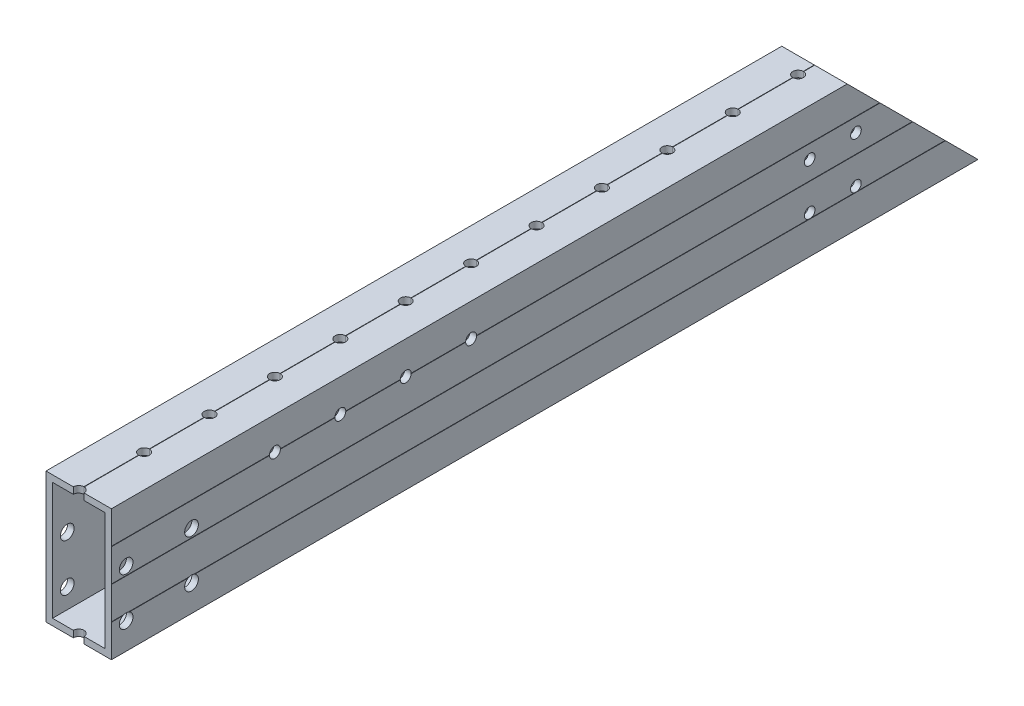
from build123d import *

# Parameters (mm, degrees)
CUT_EXTRUDE1_START          = -25.4
CUT_EXTRUDE1_OUTLINE_W      = 2.54
CUT_EXTRUDE1_OUTLINE_H      = 609.6
CUT_EXTRUDE1_DEPTH          = 50.8
CUT_EXTRUDE1_2_OUTLINE_W    = 20.32
CUT_EXTRUDE1_2_OUTLINE_H    = 609.6
CUT_EXTRUDE1_2_OUTLINE_R    = 2.0701
CUT_EXTRUDE1_2_DEPTH        = 2.54
CUT_EXTRUDE1_START_2        = 22.86
CUT_EXTRUDE1_3_OUTLINE_W    = 20.32
CUT_EXTRUDE1_3_OUTLINE_H    = 609.6
CUT_EXTRUDE1_3_OUTLINE_R    = 2.0701
CUT_EXTRUDE1_3_DEPTH        = 2.54
CUT_EXTRUDE1_START_3        = -17.906630705
CUT_EXTRUDE1_4_OUTLINE_W    = 8.980256121
CUT_EXTRUDE1_4_OUTLINE_H    = 613
CUT_EXTRUDE1_4_DEPTH        = 8.980256121
CUT_EXTRUDE1_START_4        = 8.926374584
CUT_EXTRUDE1_5_OUTLINE_W    = 8.980256121
CUT_EXTRUDE1_5_OUTLINE_H    = 613
CUT_EXTRUDE1_5_DEPTH        = 0.107763074
CUT_EXTRUDE1_START_5        = -0.053881537
CUT_EXTRUDE1_6_OUTLINE_W    = 2.093369295
CUT_EXTRUDE1_6_OUTLINE_H    = 613
CUT_EXTRUDE1_6_DEPTH        = 0.107763074
CUT_EXTRUDE1_START_6        = -26.940768363
CUT_EXTRUDE1_7_OUTLINE_W    = 2.093369295
CUT_EXTRUDE1_7_OUTLINE_H    = 613
CUT_EXTRUDE1_7_OUTLINE_W_2  = 0.107763074
CUT_EXTRUDE1_7_DEPTH        = 9.034137658
CUT_EXTRUDE1_START_7        = 17.906630705
CUT_EXTRUDE1_8_OUTLINE_W    = 0.107763074
CUT_EXTRUDE1_8_OUTLINE_H    = 613
CUT_EXTRUDE1_8_OUTLINE_W_2  = 2.093369295
CUT_EXTRUDE1_8_DEPTH        = 9.034137658
SKETCH3_W                   = 25.4
SKETCH3_H                   = 50.8
CUT_EXTRUDE3_DEPTH          = 25.4
CUT_EXTRUDE4_REACH          = 752.161
SKETCH7_W                   = 25.4
SKETCH7_H                   = 50.8
CUT_EXTRUDE6_DEPTH          = 12.7
SKETCH6_W                   = 25.4
SKETCH6_H                   = 50.8
CUT_EXTRUDE7_DEPTH          = 234.95
CUT_EXTRUDE8_DEPTH          = 234.95
CUT_EXTRUDE9_REACH          = 517.603
SKETCH9_R                   = 2.667
F_1_4_0_25_DIAMETER_HOLE1_D = 4.2545
F_1_4_0_25_DIAMETER_HOLE2_D = 4.1402


with BuildPart() as part:
    # Cut-Extrude1: read off the stored shape, not the designer's step
    # Cut-Extrude1 outline → Cut-Extrude1 (new body)
    with BuildSketch(Plane(origin=(0, 0, 0), x_dir=(1, 0, 0), z_dir=(0, 1, 0)).offset(CUT_EXTRUDE1_START)):
        with Locations((-11.43, 444.5)):
            Rectangle(CUT_EXTRUDE1_OUTLINE_W, CUT_EXTRUDE1_OUTLINE_H)
        with Locations((11.43, 444.5)):
            Rectangle(CUT_EXTRUDE1_OUTLINE_W, CUT_EXTRUDE1_OUTLINE_H)
    extrude(amount=CUT_EXTRUDE1_DEPTH)

    # Cut-Extrude1 2 outline → Cut-Extrude1 2 (add)
    with BuildSketch(Plane(origin=(0, 0, 0), x_dir=(1, 0, 0), z_dir=(0, 1, 0)).offset(CUT_EXTRUDE1_START)):
        with Locations((0, 444.5)):
            Rectangle(CUT_EXTRUDE1_2_OUTLINE_W, CUT_EXTRUDE1_2_OUTLINE_H)
        with Locations((0, 152.4)):
            Circle(CUT_EXTRUDE1_2_OUTLINE_R, mode=Mode.SUBTRACT)
        with Locations((0, 177.8)):
            Circle(CUT_EXTRUDE1_2_OUTLINE_R, mode=Mode.SUBTRACT)
        with Locations((0, 203.2)):
            Circle(CUT_EXTRUDE1_2_OUTLINE_R, mode=Mode.SUBTRACT)
        with Locations((0, 228.6)):
            Circle(CUT_EXTRUDE1_2_OUTLINE_R, mode=Mode.SUBTRACT)
        with Locations((0, 254)):
            Circle(CUT_EXTRUDE1_2_OUTLINE_R, mode=Mode.SUBTRACT)
        with Locations((0, 279.4)):
            Circle(CUT_EXTRUDE1_2_OUTLINE_R, mode=Mode.SUBTRACT)
        with Locations((0, 304.8)):
            Circle(CUT_EXTRUDE1_2_OUTLINE_R, mode=Mode.SUBTRACT)
        with Locations((0, 330.2)):
            Circle(CUT_EXTRUDE1_2_OUTLINE_R, mode=Mode.SUBTRACT)
        with Locations((0, 355.6)):
            Circle(CUT_EXTRUDE1_2_OUTLINE_R, mode=Mode.SUBTRACT)
        with Locations((0, 381)):
            Circle(CUT_EXTRUDE1_2_OUTLINE_R, mode=Mode.SUBTRACT)
        with Locations((0, 406.4)):
            Circle(CUT_EXTRUDE1_2_OUTLINE_R, mode=Mode.SUBTRACT)
        with Locations((0, 431.8)):
            Circle(CUT_EXTRUDE1_2_OUTLINE_R, mode=Mode.SUBTRACT)
        with Locations((0, 457.2)):
            Circle(CUT_EXTRUDE1_2_OUTLINE_R, mode=Mode.SUBTRACT)
        with Locations((0, 482.6)):
            Circle(CUT_EXTRUDE1_2_OUTLINE_R, mode=Mode.SUBTRACT)
        with Locations((0, 508)):
            Circle(CUT_EXTRUDE1_2_OUTLINE_R, mode=Mode.SUBTRACT)
        with Locations((0, 533.4)):
            Circle(CUT_EXTRUDE1_2_OUTLINE_R, mode=Mode.SUBTRACT)
        with Locations((0, 558.8)):
            Circle(CUT_EXTRUDE1_2_OUTLINE_R, mode=Mode.SUBTRACT)
        with Locations((0, 584.2)):
            Circle(CUT_EXTRUDE1_2_OUTLINE_R, mode=Mode.SUBTRACT)
        with Locations((0, 609.6)):
            Circle(CUT_EXTRUDE1_2_OUTLINE_R, mode=Mode.SUBTRACT)
        with Locations((0, 635)):
            Circle(CUT_EXTRUDE1_2_OUTLINE_R, mode=Mode.SUBTRACT)
        with Locations((0, 660.4)):
            Circle(CUT_EXTRUDE1_2_OUTLINE_R, mode=Mode.SUBTRACT)
        with Locations((0, 685.8)):
            Circle(CUT_EXTRUDE1_2_OUTLINE_R, mode=Mode.SUBTRACT)
        with Locations((0, 711.2)):
            Circle(CUT_EXTRUDE1_2_OUTLINE_R, mode=Mode.SUBTRACT)
        with Locations((0, 736.6)):
            Circle(CUT_EXTRUDE1_2_OUTLINE_R, mode=Mode.SUBTRACT)
    extrude(amount=CUT_EXTRUDE1_2_DEPTH)

    # Cut-Extrude1 3 outline → Cut-Extrude1 3 (add)
    with BuildSketch(Plane(origin=(0, 0, 0), x_dir=(1, 0, 0), z_dir=(0, 1, 0)).offset(CUT_EXTRUDE1_START_2)):
        with Locations((0, 444.5)):
            Rectangle(CUT_EXTRUDE1_3_OUTLINE_W, CUT_EXTRUDE1_3_OUTLINE_H)
        with Locations((0, 152.4)):
            Circle(CUT_EXTRUDE1_3_OUTLINE_R, mode=Mode.SUBTRACT)
        with Locations((0, 177.8)):
            Circle(CUT_EXTRUDE1_3_OUTLINE_R, mode=Mode.SUBTRACT)
        with Locations((0, 203.2)):
            Circle(CUT_EXTRUDE1_3_OUTLINE_R, mode=Mode.SUBTRACT)
        with Locations((0, 228.6)):
            Circle(CUT_EXTRUDE1_3_OUTLINE_R, mode=Mode.SUBTRACT)
        with Locations((0, 254)):
            Circle(CUT_EXTRUDE1_3_OUTLINE_R, mode=Mode.SUBTRACT)
        with Locations((0, 279.4)):
            Circle(CUT_EXTRUDE1_3_OUTLINE_R, mode=Mode.SUBTRACT)
        with Locations((0, 304.8)):
            Circle(CUT_EXTRUDE1_3_OUTLINE_R, mode=Mode.SUBTRACT)
        with Locations((0, 330.2)):
            Circle(CUT_EXTRUDE1_3_OUTLINE_R, mode=Mode.SUBTRACT)
        with Locations((0, 355.6)):
            Circle(CUT_EXTRUDE1_3_OUTLINE_R, mode=Mode.SUBTRACT)
        with Locations((0, 381)):
            Circle(CUT_EXTRUDE1_3_OUTLINE_R, mode=Mode.SUBTRACT)
        with Locations((0, 406.4)):
            Circle(CUT_EXTRUDE1_3_OUTLINE_R, mode=Mode.SUBTRACT)
        with Locations((0, 431.8)):
            Circle(CUT_EXTRUDE1_3_OUTLINE_R, mode=Mode.SUBTRACT)
        with Locations((0, 457.2)):
            Circle(CUT_EXTRUDE1_3_OUTLINE_R, mode=Mode.SUBTRACT)
        with Locations((0, 482.6)):
            Circle(CUT_EXTRUDE1_3_OUTLINE_R, mode=Mode.SUBTRACT)
        with Locations((0, 508)):
            Circle(CUT_EXTRUDE1_3_OUTLINE_R, mode=Mode.SUBTRACT)
        with Locations((0, 533.4)):
            Circle(CUT_EXTRUDE1_3_OUTLINE_R, mode=Mode.SUBTRACT)
        with Locations((0, 558.8)):
            Circle(CUT_EXTRUDE1_3_OUTLINE_R, mode=Mode.SUBTRACT)
        with Locations((0, 584.2)):
            Circle(CUT_EXTRUDE1_3_OUTLINE_R, mode=Mode.SUBTRACT)
        with Locations((0, 609.6)):
            Circle(CUT_EXTRUDE1_3_OUTLINE_R, mode=Mode.SUBTRACT)
        with Locations((0, 635)):
            Circle(CUT_EXTRUDE1_3_OUTLINE_R, mode=Mode.SUBTRACT)
        with Locations((0, 660.4)):
            Circle(CUT_EXTRUDE1_3_OUTLINE_R, mode=Mode.SUBTRACT)
        with Locations((0, 685.8)):
            Circle(CUT_EXTRUDE1_3_OUTLINE_R, mode=Mode.SUBTRACT)
        with Locations((0, 711.2)):
            Circle(CUT_EXTRUDE1_3_OUTLINE_R, mode=Mode.SUBTRACT)
        with Locations((0, 736.6)):
            Circle(CUT_EXTRUDE1_3_OUTLINE_R, mode=Mode.SUBTRACT)
    extrude(amount=CUT_EXTRUDE1_3_DEPTH)

    # Cut-Extrude1 4 outline → Cut-Extrude1 4 (cut)
    with BuildSketch(Plane(origin=(0, 0, 0), x_dir=(0.7071067811865493, 0.7071067811865457, 0), z_dir=(0.7071067811865456, -0.7071067811865496, 0)).offset(CUT_EXTRUDE1_START_3)):
        with Locations((-13.416502645, -444.5)):
            Rectangle(CUT_EXTRUDE1_4_OUTLINE_W, CUT_EXTRUDE1_4_OUTLINE_H)
    extrude(amount=CUT_EXTRUDE1_4_DEPTH, mode=Mode.SUBTRACT)

    # Cut-Extrude1 5 outline → Cut-Extrude1 5 (cut)
    with BuildSketch(Plane(origin=(0, 0, 0), x_dir=(0.7071067811865493, 0.7071067811865457, 0), z_dir=(0.7071067811865456, -0.7071067811865496, 0)).offset(CUT_EXTRUDE1_START_4)):
        with Locations((13.416502645, -444.5)):
            Rectangle(CUT_EXTRUDE1_5_OUTLINE_W, CUT_EXTRUDE1_5_OUTLINE_H)
    extrude(amount=CUT_EXTRUDE1_5_DEPTH, mode=Mode.SUBTRACT)

    # Cut-Extrude1 6 outline → Cut-Extrude1 6 (cut)
    with BuildSketch(Plane(origin=(0, 0, 0), x_dir=(0.7071067811865493, 0.7071067811865457, 0), z_dir=(0.7071067811865456, -0.7071067811865496, 0)).offset(CUT_EXTRUDE1_START_5)):
        with Locations((18.953315352, -444.5)):
            Rectangle(CUT_EXTRUDE1_6_OUTLINE_W, CUT_EXTRUDE1_6_OUTLINE_H)
        with Locations((-18.953315352, -444.5)):
            Rectangle(CUT_EXTRUDE1_6_OUTLINE_W, CUT_EXTRUDE1_6_OUTLINE_H)
    extrude(amount=CUT_EXTRUDE1_6_DEPTH, mode=Mode.SUBTRACT)

    # Cut-Extrude1 7 outline → Cut-Extrude1 7 (cut)
    with BuildSketch(Plane(origin=(0, 0, 0), x_dir=(0.7071067811865493, 0.7071067811865457, 0), z_dir=(0.7071067811865456, -0.7071067811865496, 0)).offset(CUT_EXTRUDE1_START_6)):
        with Locations((18.953315352, -444.5)):
            Rectangle(CUT_EXTRUDE1_7_OUTLINE_W, CUT_EXTRUDE1_7_OUTLINE_H)
        with Locations((0, -444.5)):
            Rectangle(CUT_EXTRUDE1_7_OUTLINE_W_2, CUT_EXTRUDE1_7_OUTLINE_H)
    extrude(amount=CUT_EXTRUDE1_7_DEPTH, mode=Mode.SUBTRACT)

    # Cut-Extrude1 8 outline → Cut-Extrude1 8 (cut)
    with BuildSketch(Plane(origin=(0, 0, 0), x_dir=(0.7071067811865493, 0.7071067811865457, 0), z_dir=(0.7071067811865456, -0.7071067811865496, 0)).offset(CUT_EXTRUDE1_START_7)):
        with Locations((0, -444.5)):
            Rectangle(CUT_EXTRUDE1_8_OUTLINE_W, CUT_EXTRUDE1_8_OUTLINE_H)
        with Locations((-18.953315352, -444.5)):
            Rectangle(CUT_EXTRUDE1_8_OUTLINE_W_2, CUT_EXTRUDE1_8_OUTLINE_H)
    extrude(amount=CUT_EXTRUDE1_8_DEPTH, mode=Mode.SUBTRACT)

    # Sketch3 → Cut-Extrude3 (cut)
    with BuildSketch(Plane.XY.offset(-139.7)):
        Rectangle(SKETCH3_W, SKETCH3_H)
    extrude(amount=-CUT_EXTRUDE3_DEPTH, mode=Mode.SUBTRACT)

    # Cut-Extrude4: up to this face of the body (flat: up to its plane)
    cut_extrude4_end = Plane(part.part.faces().sort_by_distance((12.7, -6.35, -457.2))[0])
    # Sketch5 → Cut-Extrude4 (cut, up to the picked face)
    with BuildSketch(Plane.ZY.offset(12.7), mode=Mode.PRIVATE) as cut_extrude4_sk1:
        with BuildLine():
            ThreePointArc((-708.533, -0.0762), (-711.2, 2.5908), (-713.867, -0.0762))
            Line((-713.867, -0.0762), (-711.2, -0.0762))
            Line((-711.2, -0.0762), (-708.533, -0.0762))
        make_face()
    cut_extrude4_tool1 = split(extrude(cut_extrude4_sk1.sketch, amount=-CUT_EXTRUDE4_REACH, mode=Mode.PRIVATE), bisect_by=cut_extrude4_end, keep=Keep.BOTH, mode=Mode.PRIVATE)
    # Sketch5 → Cut-Extrude4 (cut, up to the picked face)
    with BuildSketch(Plane.ZY.offset(12.7), mode=Mode.PRIVATE) as cut_extrude4_sk2:
        with BuildLine():
            Line((-711.2, -0.0762), (-713.867, -0.0762))
            ThreePointArc((-713.867, -0.0762), (-711.2, -2.7432), (-708.533, -0.0762))
            Line((-708.533, -0.0762), (-711.2, -0.0762))
        make_face()
    cut_extrude4_tool2 = split(extrude(cut_extrude4_sk2.sketch, amount=-CUT_EXTRUDE4_REACH, mode=Mode.PRIVATE), bisect_by=cut_extrude4_end, keep=Keep.BOTH, mode=Mode.PRIVATE)
    # Sketch5 → Cut-Extrude4 (cut, up to the picked face)
    with BuildSketch(Plane.ZY.offset(12.7), mode=Mode.PRIVATE) as cut_extrude4_sk3:
        with BuildLine():
            ThreePointArc((-708.533, -0.0762), (-711.2, 2.5908), (-713.867, -0.0762))
            Line((-713.867, -0.0762), (-711.2, -0.0762))
            Line((-711.2, -0.0762), (-708.533, -0.0762))
        make_face()
    cut_extrude4_tool3 = split(extrude(cut_extrude4_sk3.sketch, amount=-CUT_EXTRUDE4_REACH, mode=Mode.PRIVATE), bisect_by=cut_extrude4_end, keep=Keep.BOTH, mode=Mode.PRIVATE)
    # Sketch5 → Cut-Extrude4 (cut, up to the picked face)
    with BuildSketch(Plane.ZY.offset(12.7), mode=Mode.PRIVATE) as cut_extrude4_sk4:
        with BuildLine():
            Line((-711.2, -0.0762), (-713.867, -0.0762))
            ThreePointArc((-713.867, -0.0762), (-711.2, -2.7432), (-708.533, -0.0762))
            Line((-708.533, -0.0762), (-711.2, -0.0762))
        make_face()
    cut_extrude4_tool4 = split(extrude(cut_extrude4_sk4.sketch, amount=-CUT_EXTRUDE4_REACH, mode=Mode.PRIVATE), bisect_by=cut_extrude4_end, keep=Keep.BOTH, mode=Mode.PRIVATE)
    # Sketch5 → Cut-Extrude4 (cut, up to the picked face)
    with BuildSketch(Plane.ZY.offset(12.7), mode=Mode.PRIVATE) as cut_extrude4_sk5:
        with BuildLine():
            ThreePointArc((-673.481, -0.0762), (-676.148, 2.5908), (-678.815, -0.0762))
            Line((-678.815, -0.0762), (-673.481, -0.0762))
        make_face()
    cut_extrude4_tool5 = split(extrude(cut_extrude4_sk5.sketch, amount=-CUT_EXTRUDE4_REACH, mode=Mode.PRIVATE), bisect_by=cut_extrude4_end, keep=Keep.BOTH, mode=Mode.PRIVATE)
    # Sketch5 → Cut-Extrude4 (cut, up to the picked face)
    with BuildSketch(Plane.ZY.offset(12.7), mode=Mode.PRIVATE) as cut_extrude4_sk6:
        with BuildLine():
            Line((-673.481, -0.0762), (-678.815, -0.0762))
            ThreePointArc((-678.815, -0.0762), (-676.148, -2.7432), (-673.481, -0.0762))
        make_face()
    cut_extrude4_tool6 = split(extrude(cut_extrude4_sk6.sketch, amount=-CUT_EXTRUDE4_REACH, mode=Mode.PRIVATE), bisect_by=cut_extrude4_end, keep=Keep.BOTH, mode=Mode.PRIVATE)
    # Sketch5 → Cut-Extrude4 (cut, up to the picked face)
    with BuildSketch(Plane.ZY.offset(12.7), mode=Mode.PRIVATE) as cut_extrude4_sk7:
        with BuildLine():
            ThreePointArc((-673.481, -0.0762), (-676.148, 2.5908), (-678.815, -0.0762))
            Line((-678.815, -0.0762), (-673.481, -0.0762))
        make_face()
    cut_extrude4_tool7 = split(extrude(cut_extrude4_sk7.sketch, amount=-CUT_EXTRUDE4_REACH, mode=Mode.PRIVATE), bisect_by=cut_extrude4_end, keep=Keep.BOTH, mode=Mode.PRIVATE)
    # Sketch5 → Cut-Extrude4 (cut, up to the picked face)
    with BuildSketch(Plane.ZY.offset(12.7), mode=Mode.PRIVATE) as cut_extrude4_sk8:
        with BuildLine():
            Line((-673.481, -0.0762), (-678.815, -0.0762))
            ThreePointArc((-678.815, -0.0762), (-676.148, -2.7432), (-673.481, -0.0762))
        make_face()
    cut_extrude4_tool8 = split(extrude(cut_extrude4_sk8.sketch, amount=-CUT_EXTRUDE4_REACH, mode=Mode.PRIVATE), bisect_by=cut_extrude4_end, keep=Keep.BOTH, mode=Mode.PRIVATE)
    add(cut_extrude4_tool1.solids().sort_by(Axis((-12.7, 1.05571, -711.2), (1, 0, 0)))[0], mode=Mode.SUBTRACT)
    add(cut_extrude4_tool2.solids().sort_by(Axis((-12.7, -1.20811, -711.2), (1, 0, 0)))[0], mode=Mode.SUBTRACT)
    add(cut_extrude4_tool3.solids().sort_by(Axis((-12.7, 1.05571, -711.2), (1, 0, 0)))[0], mode=Mode.SUBTRACT)
    add(cut_extrude4_tool4.solids().sort_by(Axis((-12.7, -1.20811, -711.2), (1, 0, 0)))[0], mode=Mode.SUBTRACT)
    add(cut_extrude4_tool5.solids().sort_by(Axis((-12.7, 1.05571, -676.148), (1, 0, 0)))[0], mode=Mode.SUBTRACT)
    add(cut_extrude4_tool6.solids().sort_by(Axis((-12.7, -1.20811, -676.148), (1, 0, 0)))[0], mode=Mode.SUBTRACT)
    add(cut_extrude4_tool7.solids().sort_by(Axis((-12.7, 1.05571, -676.148), (1, 0, 0)))[0], mode=Mode.SUBTRACT)
    add(cut_extrude4_tool8.solids().sort_by(Axis((-12.7, -1.20811, -676.148), (1, 0, 0)))[0], mode=Mode.SUBTRACT)

    # Sketch7 → Cut-Extrude6 (cut)
    with BuildSketch(Plane.XY.offset(-165.1)):
        Rectangle(SKETCH7_W, SKETCH7_H)
    extrude(amount=-CUT_EXTRUDE6_DEPTH, mode=Mode.SUBTRACT)

    # Sketch6 → Cut-Extrude7 (cut)
    with BuildSketch(Plane(origin=(0, 0, -749.3), x_dir=(-1, 0, 0), z_dir=(0, 0, -1))):
        Rectangle(SKETCH6_W, SKETCH6_H)
    extrude(amount=-CUT_EXTRUDE7_DEPTH, mode=Mode.SUBTRACT)

    # Sketch8 → Cut-Extrude8 (cut)
    with BuildSketch(Plane(origin=(12.7, 0, 0), x_dir=(0, 0, -1), z_dir=(1, 0, 0))):
        Polygon((514.35, -25.4), (463.55, 25.4), (514.35, 25.4), align=None)
    extrude(amount=-CUT_EXTRUDE8_DEPTH, mode=Mode.SUBTRACT)

    # Cut-Extrude9: up to this face of the body (flat: up to its plane)
    cut_extrude9_end = Plane(part.part.faces().sort_by_distance((12.7, -19.128313492, -342.939156746))[0])
    # Sketch9 → Cut-Extrude9 (cut, up to the picked face)
    with BuildSketch(Plane.ZY.offset(12.7), mode=Mode.PRIVATE) as cut_extrude9_sk1:
        with Locations(Location((-208.915, -15.122902698, 0), (0, 0, 61.63072775))):
            Circle(SKETCH9_R)
    cut_extrude9_tool1 = split(extrude(cut_extrude9_sk1.sketch, amount=-CUT_EXTRUDE9_REACH, mode=Mode.PRIVATE), bisect_by=cut_extrude9_end, keep=Keep.BOTH, mode=Mode.PRIVATE)
    # Sketch9 → Cut-Extrude9 (cut, up to the picked face)
    with BuildSketch(Plane.ZY.offset(12.7), mode=Mode.PRIVATE) as cut_extrude9_sk2:
        with Locations((-208.915, 3.279397302)):
            Circle(SKETCH9_R)
    cut_extrude9_tool2 = split(extrude(cut_extrude9_sk2.sketch, amount=-CUT_EXTRUDE9_REACH, mode=Mode.PRIVATE), bisect_by=cut_extrude9_end, keep=Keep.BOTH, mode=Mode.PRIVATE)
    # Sketch9 → Cut-Extrude9 (cut, up to the picked face)
    with BuildSketch(Plane.ZY.offset(12.7), mode=Mode.PRIVATE) as cut_extrude9_sk3:
        with Locations((-183.515, 3.279397302)):
            Circle(SKETCH9_R)
    cut_extrude9_tool3 = split(extrude(cut_extrude9_sk3.sketch, amount=-CUT_EXTRUDE9_REACH, mode=Mode.PRIVATE), bisect_by=cut_extrude9_end, keep=Keep.BOTH, mode=Mode.PRIVATE)
    # Sketch9 → Cut-Extrude9 (cut, up to the picked face)
    with BuildSketch(Plane.ZY.offset(12.7), mode=Mode.PRIVATE) as cut_extrude9_sk4:
        with Locations(Location((-183.515, -15.122902698, 0), (0, 0, 61.63072775))):
            Circle(SKETCH9_R)
    cut_extrude9_tool4 = split(extrude(cut_extrude9_sk4.sketch, amount=-CUT_EXTRUDE9_REACH, mode=Mode.PRIVATE), bisect_by=cut_extrude9_end, keep=Keep.BOTH, mode=Mode.PRIVATE)
    add(cut_extrude9_tool1.solids().sort_by(Axis((-12.7, -15.122903, -208.915), (1, 0, 0)))[0], mode=Mode.SUBTRACT)
    add(cut_extrude9_tool2.solids().sort_by(Axis((-12.7, 3.279397, -208.915), (1, 0, 0)))[0], mode=Mode.SUBTRACT)
    add(cut_extrude9_tool3.solids().sort_by(Axis((-12.7, 3.279397, -183.515), (1, 0, 0)))[0], mode=Mode.SUBTRACT)
    add(cut_extrude9_tool4.solids().sort_by(Axis((-12.7, -15.122903, -183.515), (1, 0, 0)))[0], mode=Mode.SUBTRACT)

    # 1/4 (0.25) Diameter Hole1 (through all)
    with Locations(Plane(origin=(12.7, 0, 0), x_dir=(0, 0, -1), z_dir=(1, 0, 0))):
        with Locations((317.5, 12.7), (292.1, 12.7), (266.7, 12.7), (241.3, 12.7)):
            Hole(F_1_4_0_25_DIAMETER_HOLE1_D / 2)

    # 1/4 (0.25) Diameter Hole2 (through all)
    with Locations(Plane.ZY.offset(12.7)):
        with Locations((-448.97983229, 7.26769692), (-466.943974162, 7.312854818), (-466.940269064, -10.654839752), (-448.983783006, -10.63910877)):
            Hole(F_1_4_0_25_DIAMETER_HOLE2_D / 2)


solid = part.part
